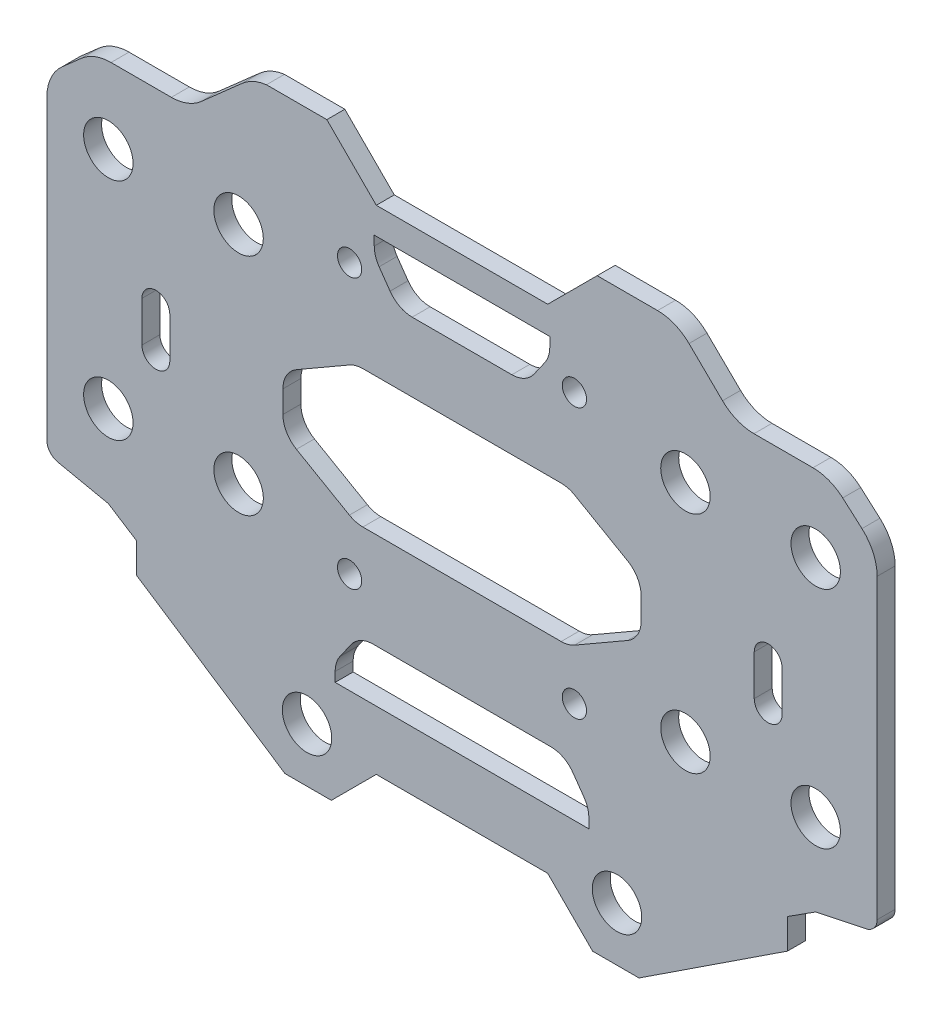
from build123d import *

# Parameters (mm, degrees)
SKETCH_192_R    = 2.75
SKETCH_192_R_2  = 1.35
EXTRUDE_1_DEPTH = 2
FILLET_1_R      = 3


with BuildPart() as part:
    # Sketch 192 → 凸台-拉伸1 (new body)
    with BuildSketch(Plane.XY):
        with BuildLine():
            Line((-24.447800114, 142.867788384), (-29.015821613, 138.834288737))
            ThreePointArc((-29.015821613, 138.834288737), (-30.556091587, 137.905760103), (-32.325263946, 137.582300402))
            Line((-32.325263946, 137.582300402), (-39.033457742, 137.582300402))
            ThreePointArc((-39.033457742, 137.582300402), (-40.802630101, 137.2588407), (-42.342900075, 136.330312067))
            Line((-42.342900075, 136.330312067), (-44.480254451, 134.443057788))
            ThreePointArc((-44.480254451, 134.443057788), (-45.728619247, 132.750865708), (-46.170812117, 130.695046123))
            Line((-46.170812117, 130.695046123), (-46.170812117, 97.620783931))
            ThreePointArc((-46.170812117, 97.620783931), (-45.830898888, 96.66237235), (-44.963075466, 96.132300402))
            Line((-44.963075466, 96.132300402), (-39.335406059, 94.947479812))
            Line((-39.335406059, 94.947479812), (-36.200029499, 92.942583722))
            Line((-36.200029499, 92.942583722), (-36.200029499, 89.608050871))
            Line((-36.200029499, 89.608050871), (-19.688242157, 78.763336754))
            Line((-19.688242157, 78.763336754), (-14.532154357, 78.763336754))
            Line((-14.532154357, 78.763336754), (-9.532154357, 83.763336754))
            Line((-9.532154357, 83.763336754), (9.532154357, 83.763336754))
            Line((9.532154357, 83.763336754), (14.532154357, 78.763336754))
            Line((14.532154357, 78.763336754), (19.688242157, 78.763336754))
            Line((19.688242157, 78.763336754), (36.200029499, 89.608050871))
            Line((36.200029499, 89.608050871), (36.200029499, 92.942583722))
            Line((36.200029499, 92.942583722), (39.335406059, 94.947479812))
            Line((39.335406059, 94.947479812), (44.963075466, 96.132300402))
            ThreePointArc((44.963075466, 96.132300402), (45.830898888, 96.66237235), (46.170812117, 97.620783931))
            Line((46.170812117, 97.620783931), (46.170812117, 130.695046123))
            ThreePointArc((46.170812117, 130.695046123), (45.728619247, 132.750865708), (44.480254451, 134.443057788))
            Line((44.480254451, 134.443057788), (42.342900075, 136.330312067))
            ThreePointArc((42.342900075, 136.330312067), (40.802630101, 137.2588407), (39.033457742, 137.582300402))
            Line((39.033457742, 137.582300402), (32.472417217, 137.582300402))
            ThreePointArc((32.472417217, 137.582300402), (30.584617738, 137.952374579), (28.976268595, 139.007815151))
            Line((28.976268595, 139.007815151), (25.245537252, 142.656785653))
            ThreePointArc((25.245537252, 142.656785653), (23.637188108, 143.712226225), (21.74938863, 144.082300402))
            Line((21.74938863, 144.082300402), (15.032154357, 144.082300402))
            Line((15.032154357, 144.082300402), (9.532154357, 138.582300402))
            Line((9.532154357, 138.582300402), (-9.532154357, 138.582300402))
            Line((-9.532154357, 138.582300402), (-15.032154357, 144.082300402))
            Line((-15.032154357, 144.082300402), (-21.74938863, 144.082300402))
            ThreePointArc((-21.74938863, 144.082300402), (-23.190499918, 143.679240794), (-24.447800114, 142.867788384))
        make_face()
        with Locations((39.335406059, 129.082300402)):
            Circle(SKETCH_192_R, mode=Mode.SUBTRACT)
        with Locations((39.335406059, 104.082300402)):
            Circle(SKETCH_192_R, mode=Mode.SUBTRACT)
        with Locations((17.23796389, 84.763336754)):
            Circle(SKETCH_192_R, mode=Mode.SUBTRACT)
        with Locations((-17.23796389, 84.763336754)):
            Circle(SKETCH_192_R, mode=Mode.SUBTRACT)
        with Locations((-39.335406059, 104.082300402)):
            Circle(SKETCH_192_R, mode=Mode.SUBTRACT)
        with Locations((-39.335406059, 129.082300402)):
            Circle(SKETCH_192_R, mode=Mode.SUBTRACT)
        with Locations((24.85, 129.082300402)):
            Circle(SKETCH_192_R, mode=Mode.SUBTRACT)
        with Locations((-24.85, 129.082300402)):
            Circle(SKETCH_192_R, mode=Mode.SUBTRACT)
        with Locations((-24.85, 104.082300402)):
            Circle(SKETCH_192_R, mode=Mode.SUBTRACT)
        with Locations((24.85, 104.082300402)):
            Circle(SKETCH_192_R, mode=Mode.SUBTRACT)
        with Locations((12.5, 131.582300402)):
            Circle(SKETCH_192_R_2, mode=Mode.SUBTRACT)
        with Locations((-12.5, 131.582300402)):
            Circle(SKETCH_192_R_2, mode=Mode.SUBTRACT)
        with Locations((-12.5, 101.582300402)):
            Circle(SKETCH_192_R_2, mode=Mode.SUBTRACT)
        with Locations((12.5, 101.582300402)):
            Circle(SKETCH_192_R_2, mode=Mode.SUBTRACT)
        Polygon((11.452883203, 96.132300402), (-11.452883203, 96.132300402), (-14.108965813, 92.339021317), (-14.108965813, 90.339021317), (14.108965813, 90.339021317), (14.108965813, 92.339021317), align=None, mode=Mode.SUBTRACT)
        with BuildLine():
            Line((-35.6, 116.582300402), (-35.6, 112.082300402))
            ThreePointArc((-35.6, 112.082300402), (-34.05, 110.532300402), (-32.5, 112.082300402))
            Line((-32.5, 112.082300402), (-32.5, 116.582300402))
            ThreePointArc((-32.5, 116.582300402), (-34.05, 118.132300402), (-35.6, 116.582300402))
        make_face(mode=Mode.SUBTRACT)
        with BuildLine():
            Line((35.6, 116.582300402), (35.6, 112.082300402))
            ThreePointArc((35.6, 112.082300402), (34.05, 110.532300402), (32.5, 112.082300402))
            Line((32.5, 112.082300402), (32.5, 116.582300402))
            ThreePointArc((32.5, 116.582300402), (34.05, 118.132300402), (35.6, 116.582300402))
        make_face(mode=Mode.SUBTRACT)
        Polygon((-19.91879249, 111.503250786), (-11.830043147, 106.844014427), (11.830043147, 106.844014427), (19.91879249, 111.503250786), (19.91879249, 117.441133715), (11.830043147, 122.100370075), (-11.830043147, 122.100370075), (-19.91879249, 117.441133715), align=None, mode=Mode.SUBTRACT)
        Polygon((-7.105388598, 129.79821171), (7.105388598, 129.79821171), (9.761471208, 133.591490795), (9.761471208, 135.591490795), (-9.761471208, 135.591490795), (-9.761471208, 133.591490795), align=None, mode=Mode.SUBTRACT)
    extrude(amount=EXTRUDE_1_DEPTH)

    # 圆角1
    fillet_1_edges = [part.edges().sort_by_distance(p)[0] for p in [
        (-9.761471208, 133.591490795, 1),
        (9.761471208, 133.591490795, 1),
        (7.105388598, 129.79821171, 1),
        (-7.105388598, 129.79821171, 1),
        (14.108965813, 92.339021317, 1),
        (-14.108965813, 92.339021317, 1),
        (11.452883203, 96.132300402, 1),
        (-11.452883203, 96.132300402, 1),
        (11.830043147, 106.844014427, 1),
        (19.91879249, 111.503250786, 1),
        (-11.830043147, 106.844014427, 1),
        (-19.91879249, 111.503250786, 1),
        (19.91879249, 117.441133715, 1),
        (11.830043147, 122.100370075, 1),
        (-19.91879249, 117.441133715, 1),
        (-11.830043147, 122.100370075, 1),
    ]]
    fillet(fillet_1_edges, radius=FILLET_1_R)


solid = part.part
